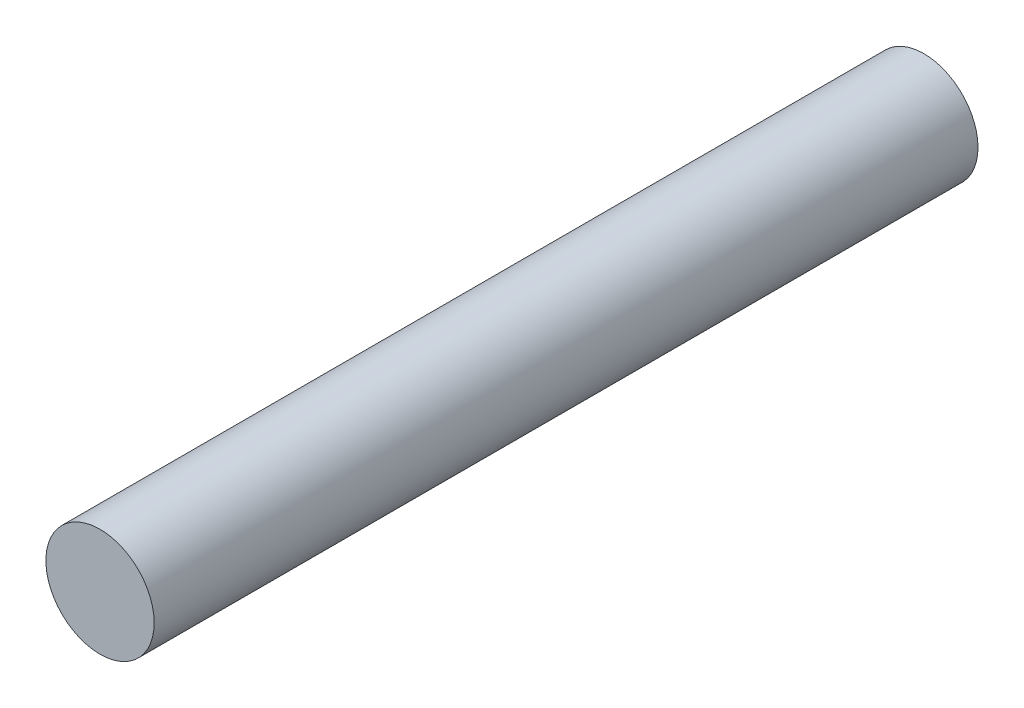
from build123d import *

# Parameters (mm, degrees)
ESTRUSIONE_ESTRUSIONE1_DEPTH      = 190.25
ESTRUSIONE_ESTRUSIONE1_DEPTH_BACK = 190.25
SCHIZZO1_R                        = 25


with BuildPart() as part:
    # Schizzo1 → Estrusione-Estrusione1 (new, two sides: drawn at the far end of the back side and taken through both)
    with BuildSketch(Plane.XY.offset(-ESTRUSIONE_ESTRUSIONE1_DEPTH_BACK)):
        Circle(SCHIZZO1_R)
    extrude(amount=ESTRUSIONE_ESTRUSIONE1_DEPTH + ESTRUSIONE_ESTRUSIONE1_DEPTH_BACK)


solid = part.part
